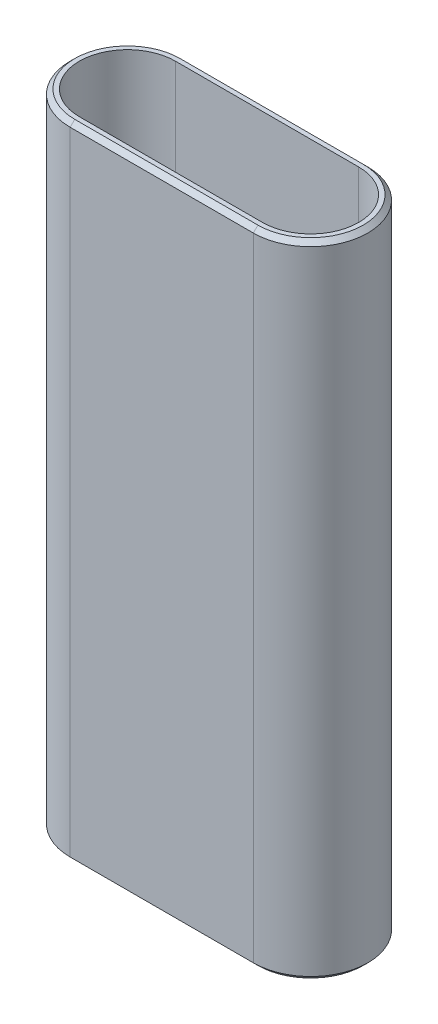
from build123d import *

# Parameters (mm, degrees)
SKETCH2_W               = 14.9
SKETCH2_H               = 11.7
SKETCH2_W_2             = 8.7
SKETCH2_H_2             = 7.7
BOSS_EXTRUDE1_DEPTH     = 12.6
CUT_EXTRUDE1_DEPTH      = 16.288067242
CUT_EXTRUDE1_DEPTH_BACK = 16.288067242
SKETCH4_W               = 4.6
SKETCH4_H               = 3.25
BOSS_EXTRUDE2_DEPTH     = 3
BOSS_EXTRUDE3_START     = 137
BOSS_EXTRUDE3_DEPTH     = 137
CHAMFER1_SIZE           = 1
CHAMFER2_SIZE           = 0.8
CHAMFER3_SIZE           = 2


with BuildPart() as part:
    # Sketch2 → Boss-Extrude1 (new body)
    with BuildSketch(Plane.XZ.offset(-12)):
        Rectangle(SKETCH2_W, SKETCH2_H)
        Rectangle(SKETCH2_W_2, SKETCH2_H_2, mode=Mode.SUBTRACT)
    extrude(amount=BOSS_EXTRUDE1_DEPTH)

    # Sketch4 → Cut-Extrude1 (cut, two sides: drawn at the far end of the back side and taken through both)
    with BuildSketch(Plane(origin=(0, 0, 0), x_dir=(0, 0, -1), z_dir=(1, 0, 0)).offset(-CUT_EXTRUDE1_DEPTH_BACK)):
        with Locations((0, 8.625)):
            Rectangle(SKETCH4_W, SKETCH4_H)
    extrude(amount=CUT_EXTRUDE1_DEPTH + CUT_EXTRUDE1_DEPTH_BACK, mode=Mode.SUBTRACT)

    # Sketch5 → Boss-Extrude2 (add)
    with BuildSketch(Plane.XZ.offset(0.6)):
        with BuildLine():
            Line((-20, 12.5), (20, 12.5))
            ThreePointArc((20, 12.5), (32.5, 0), (20, -12.5))
            Line((20, -12.5), (-20, -12.5))
            ThreePointArc((-20, -12.5), (-32.5, 0), (-20, 12.5))
        make_face()
    extrude(amount=BOSS_EXTRUDE2_DEPTH)

    # Sketch7 → Boss-Extrude3 (add)
    with BuildSketch(Plane(origin=(0, -0.6, 0), x_dir=(1, 0, 0), z_dir=(0, 1, 0)).offset(BOSS_EXTRUDE3_START)):
        with BuildLine():
            Line((-20, -12.5), (20, -12.5))
            ThreePointArc((20, -12.5), (32.5, 0), (20, 12.5))
            Line((20, 12.5), (-20, 12.5))
            ThreePointArc((-20, 12.5), (-32.5, 0), (-20, -12.5))
        make_face()
        with BuildLine():
            Line((-20, -10.5), (20, -10.5))
            ThreePointArc((20, -10.5), (30.5, 0), (20, 10.5))
            Line((20, 10.5), (-20, 10.5))
            ThreePointArc((-20, 10.5), (-30.5, 0), (-20, -10.5))
        make_face(mode=Mode.SUBTRACT)
    extrude(amount=-BOSS_EXTRUDE3_DEPTH)

    # Chamfer1
    chamfer1_edges = [part.edges().sort_by_distance(p)[0] for p in [
        (-32.5, -3.6, 0),
        (0, -3.6, -12.5),
        (32.5, -3.6, 0),
        (0, -3.6, 12.5),
        (-32.5, 136.4, 0),
        (0, 136.4, 12.5),
        (32.5, 136.4, 0),
        (0, 136.4, -12.5),
    ]]
    chamfer(chamfer1_edges, length=CHAMFER1_SIZE)

    # Chamfer2
    chamfer2_edges = [part.edges().sort_by_distance(p)[0] for p in [
        (0, 12, -3.85),
        (4.35, 12, 0),
        (0, 12, 3.85),
        (-4.35, 12, 0),
        (0, 12, -5.85),
        (-7.45, 12, 0),
        (0, 12, 5.85),
        (7.45, 12, 0),
    ]]
    chamfer(chamfer2_edges, length=CHAMFER2_SIZE)

    # Chamfer3
    # the kernel refuses this chamfer: 2 mm, written as the material it takes off along each edge
    with BuildSketch(Plane(origin=(-7.45, 16.343365976, 5.85), x_dir=(-0.027495876610586053, 0, -0.9996219169112968), z_dir=(0, -1, 0)), Plane(origin=(7.45, 16.343365976, 5.85), x_dir=(-0.9996219169112968, 0, 0.027495876610586487), z_dir=(0, -1, 0))) as chamfer3_piece_1:
        Polygon((CHAMFER3_SIZE * 0.999621916911, CHAMFER3_SIZE * 0.0274958766106), (-CHAMFER3_SIZE * 0.0274958766106, CHAMFER3_SIZE * 0.999621916911), (0, 0), align=None)
    extrude(amount=16.943365976, mode=Mode.SUBTRACT)
    with BuildSketch(Plane(origin=(-7.45, 16.343365976, -5.85), x_dir=(-0.027495876610586924, 0, 0.9996219169112968), z_dir=(0, -1, 0)), Plane(origin=(7.45, 16.343365976, -5.85), x_dir=(-0.9996219169112968, 0, -0.027495876610586487), z_dir=(0, -1, 0))) as chamfer3_piece_2:
        Polygon((CHAMFER3_SIZE * 0.999621916911, -CHAMFER3_SIZE * 0.0274958766106), (-CHAMFER3_SIZE * 0.0274958766106, -CHAMFER3_SIZE * 0.999621916911), (0, 0), align=None)
    extrude(amount=16.943365976, mode=Mode.SUBTRACT)


solid = part.part
